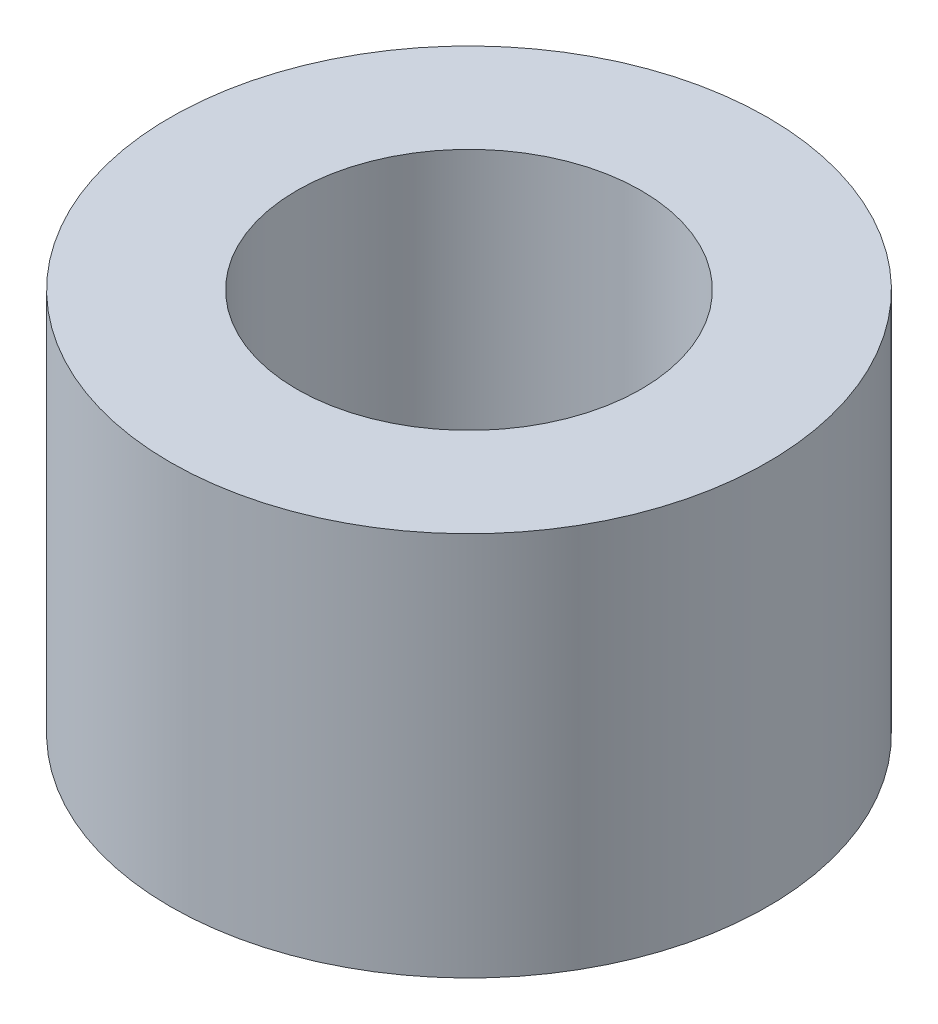
from build123d import *

# Parameters (mm, degrees)
SKETCH2_R           = 2.95
SKETCH2_R_2         = 1.7
BOSS_EXTRUDE1_DEPTH = 3.8


with BuildPart() as part:
    # Sketch2 → Boss-Extrude1 (new body)
    with BuildSketch(Plane(origin=(0, 0, 0), x_dir=(1, 0, 0), z_dir=(0, 1, 0))):
        Circle(SKETCH2_R)
        Circle(SKETCH2_R_2, mode=Mode.SUBTRACT)
    extrude(amount=BOSS_EXTRUDE1_DEPTH)


solid = part.part
